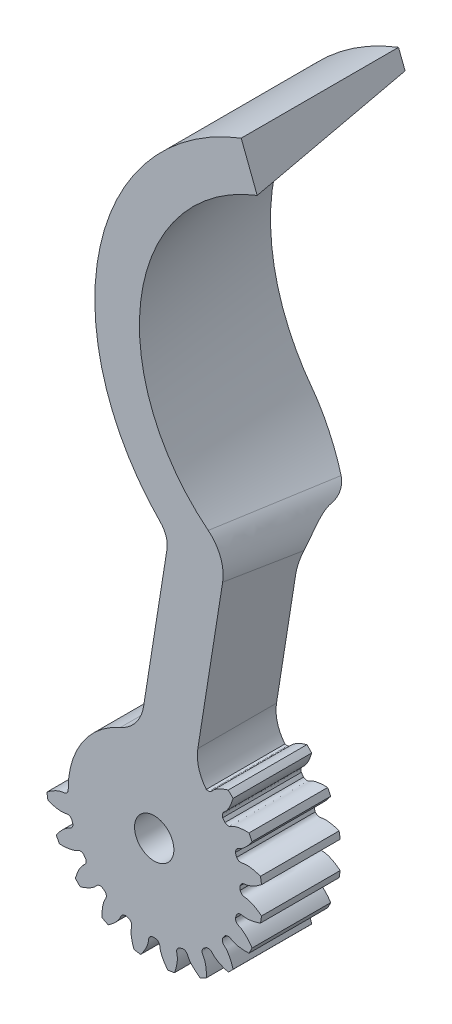
from build123d import *

# Parameters (mm, degrees)
SKETCH_1_R               = 13.75
EXTRUDE_1_DEPTH          = 10
CUT_EXTRUDE_1_DEPTH      = 22.86606960566988
PATTERN_CIRCULAR_1_COUNT = 20
EXTRUDE_2_DEPTH          = 10
EXTRUDE_2_DEPTH_BACK     = 10
CUT_EXTRUDE_3_DEPTH      = 10
CUT_EXTRUDE_3_DEPTH_BACK = 32
SKETCH_16_R              = 2.5
CUT_EXTRUDE_5_DEPTH      = 16.5
SKETCH_19_R              = 8
CUT_EXTRUDE_7_DEPTH      = 3.4
CUT_EXTRUDE_8_DEPTH      = 10
CUT_EXTRUDE_START        = -10
CUT_EXTRUDE_10_DEPTH     = 10
FILLET_7_R               = 5
FILLET_9_R               = 3
FILLET_START             = -13.204378906
FILLET_10_DEPTH          = 16.704378906
FILLET_START_2           = -3.918757741
FILLET_10_2_DEPTH        = 7.418757741
FILLET_START_3           = -7.840442154
FILLET_10_3_DEPTH        = 7.840442154
FILLET_11_R              = 5


with BuildPart() as part:
    # 草图1 → 凸台-拉伸1 (new body)
    with BuildSketch(Plane.XY):
        Circle(SKETCH_1_R)
    extrude(amount=EXTRUDE_1_DEPTH)

    # 草图2 → 切除-拉伸1 (cut, through all)
    with BuildSketch(Plane.XY):
        with BuildLine():
            ThreePointArc((0.2416457505997634, 10.934830295035086), (6.7e-16, 10.937500000000002), (-0.2416457505997634, 10.934830295035086))
            add(Edge.make_bspline(
                [(-0.2416457505997634, 10.934830295035086), (-0.7639867559471274, 11.11684438996315), (-0.6963551242057641, 11.483892123624184), (-0.7661213205046493, 11.837511753136502), (-0.7736152328233113, 11.871945767425867), (-0.7828886122849474, 11.910793269010291), (-0.7941151212463513, 11.953996045052806), (-0.8074739252556283, 12.001489371071028), (-0.8231400688185614, 12.05320353502386), (-0.8412873393390029, 12.109063416272766), (-0.862087187379229, 12.168988683784418), (-0.8857088747961671, 12.232893806456804), (-0.9123192481543054, 12.300688125650764), (-0.9420826277741565, 12.372275913376424), (-0.9751606640715431, 12.447556439261257), (-1.0117122057689227, 12.526424039316826), (-1.0518931668071612, 12.60876818853259), (-1.0958563959484007, 12.694473576645077), (-1.1437515479964713, 12.783420187219072), (-1.1957249570475372, 12.87548337994386), (-1.2519195117493733, 12.970533976112947), (-1.312474532673087, 13.068438347234778), (-1.3775256518637333, 13.169058506725253), (-1.4472046946457964, 13.272252204629972), (-1.5216395637554152, 13.377873025322454), (-1.6009541258709281, 13.485770488123043), (-1.6852681006117873, 13.59579015078136), (-1.7746969520747922, 13.707773715763658), (-1.8693517829750321, 13.821559139284766), (-1.9693392314578595, 13.93698074302268), (-2.0747613706463635, 14.053869328452425), (-2.185715610988071, 14.17205229373418), (-2.302294605461247, 14.291353753089297), (-2.4245861577060728, 14.411594658596073), (-2.5526731331198365, 14.532592924337251), (-2.6866333730491396, 14.654163552823087), (-2.826539611839227, 14.776118763640085), (-2.9724593979402836, 14.898268124165542), (-3.124455014680454, 15.020418682609423), (-3.282583417956758, 15.142375102006111), (-3.4468961243493603, 15.263939800114537), (-3.676841988482957, 15.427049834589285), (-3.8549155156667996, 15.545415751343372), (-3.9764474773063805, 15.622814824574697)],
                knots=[0, 0, 0, 0, 0.1659160033276296, 0.17090592154423187, 0.1766635194393566, 0.18318879701815147, 0.1904817542841364, 0.19854239123982698, 0.20737070788708242, 0.21696670422731487, 0.22733038026162405, 0.2384617359908808, 0.2503607714157882, 0.2630274865369212, 0.27646188135475647, 0.29066395586969274, 0.3056337100820685, 0.3213711439921716, 0.33787625760025025, 0.3551490509065194, 0.37318952391116655, 0.391997676614357, 0.41157350901623546, 0.4319170211169303, 0.45302821291655715, 0.474907084415218, 0.49755363561300586, 0.5209678665100028, 0.5451497771062851, 0.5700993674019202, 0.5958166373969708, 0.6223015870914939, 0.6495542164855408, 0.6775745255791595, 0.7063625143723938, 0.7359181828652848, 0.7662415310578692, 0.7973325589501815, 0.8291912665422545, 0.8618176538341175, 0.8952117208257987, 0.9293734675173234, 1, 1, 1, 1], degree=3))
            ThreePointArc((-3.9764474773063805, 15.622814824574697), (9.9e-16, 16.120932900509423), (3.9764474773063805, 15.622814824574697))
            add(Edge.make_bspline(
                [(0.2416457505997634, 10.934830295035086), (0.7639867559471264, 11.116844389963001), (0.6963551242057642, 11.48389212362419), (0.7661213205046493, 11.837511753136502), (0.7736152328233113, 11.871945767425867), (0.7828886122849474, 11.910793269010291), (0.7941151212463513, 11.953996045052806), (0.8074739252556281, 12.001489371071031), (0.8231400688185614, 12.05320353502386), (0.8412873393390029, 12.109063416272766), (0.862087187379229, 12.168988683784416), (0.885708874796167, 12.232893806456804), (0.9123192481543055, 12.300688125650764), (0.9420826277741565, 12.372275913376424), (0.9751606640715431, 12.447556439261259), (1.011712205768923, 12.526424039316826), (1.051893166807161, 12.60876818853259), (1.0958563959484007, 12.694473576645073), (1.143751547996471, 12.783420187219072), (1.1957249570475375, 12.875483379943862), (1.251919511749373, 12.970533976112947), (1.312474532673087, 13.068438347234776), (1.3775256518637333, 13.169058506725252), (1.4472046946457964, 13.272252204629972), (1.521639563755415, 13.377873025322454), (1.6009541258709281, 13.485770488123041), (1.6852681006117871, 13.59579015078136), (1.7746969520747922, 13.707773715763658), (1.8693517829750321, 13.821559139284766), (1.969339231457859, 13.936980743022678), (2.074761370646364, 14.053869328452427), (2.1857156109880704, 14.17205229373418), (2.302294605461247, 14.291353753089297), (2.4245861577060728, 14.411594658596073), (2.5526731331198365, 14.532592924337251), (2.6866333730491396, 14.654163552823087), (2.826539611839227, 14.776118763640085), (2.972459397940284, 14.898268124165542), (3.1244550146804544, 15.020418682609423), (3.282583417956758, 15.142375102006111), (3.4468961243493608, 15.263939800114537), (3.6768419884829564, 15.427049834589285), (3.854915515666801, 15.545415751343368), (3.9764474773063805, 15.622814824574697)],
                knots=[0, 0, 0, 0, 0.1659160033276296, 0.17090592154423187, 0.1766635194393566, 0.18318879701815147, 0.1904817542841364, 0.19854239123982698, 0.20737070788708242, 0.21696670422731487, 0.22733038026162405, 0.2384617359908808, 0.2503607714157882, 0.2630274865369212, 0.27646188135475647, 0.29066395586969274, 0.3056337100820685, 0.3213711439921716, 0.33787625760025025, 0.3551490509065194, 0.37318952391116655, 0.391997676614357, 0.41157350901623546, 0.4319170211169303, 0.45302821291655715, 0.474907084415218, 0.49755363561300586, 0.5209678665100028, 0.5451497771062851, 0.5700993674019202, 0.5958166373969708, 0.6223015870914939, 0.6495542164855408, 0.6775745255791595, 0.7063625143723938, 0.7359181828652848, 0.7662415310578692, 0.7973325589501815, 0.8291912665422545, 0.8618176538341175, 0.8952117208257987, 0.9293734675173234, 1, 1, 1, 1], degree=3))
        make_face()
    cut_extrude_1 = extrude(amount=CUT_EXTRUDE_1_DEPTH, mode=Mode.SUBTRACT)

    # 阵列(圆周)1: 切除-拉伸1 ×20 about axis
    pattern_circular_1_axis = Axis((0, 0, -1.5000000000000013), (0, 0, 1))
    for i in range(1, PATTERN_CIRCULAR_1_COUNT):
        add(cut_extrude_1.rotate(pattern_circular_1_axis, i * 360 / PATTERN_CIRCULAR_1_COUNT), mode=Mode.SUBTRACT)

    # 草图6 → 凸台-拉伸2 (add, two sides: drawn at the far end of the back side and taken through both)
    with BuildSketch(Plane(origin=(0, 0, 0), x_dir=(-1, 0, 0), z_dir=(0, 0, -1)).offset(-EXTRUDE_2_DEPTH_BACK)):
        with BuildLine():
            Line((-3.4569091920829877, -0.5475206276408102), (3.456909192082978, 0.5475206276408082))
            Line((3.4569091920829775, 0.5475206276408082), (-1.8670604289446535, 34.16174188648786))
            ThreePointArc((-1.867060428944658, 34.16174188648786), (7.038032774036104, 60.95334554573874), (-11.06104827526795, 82.62161674486494))
            Line((-11.06104827526795, 82.62161674486494), (-15.003095720266115, 72.35223205339587))
            Line((-15.003095720266115, 72.35223205339587), (-3.4569091920829873, -0.5475206276408073))
        make_face()
    extrude(amount=EXTRUDE_2_DEPTH + EXTRUDE_2_DEPTH_BACK)

    # 草图7 → 切除-拉伸3 (cut, two sides: drawn at the far end of the back side and taken through both)
    with BuildSketch(Plane(origin=(-3.456909192082979, 0.5475206276408087, 0), x_dir=(0, 0, -1), z_dir=(0.9876883405951378, -0.15643446504023117, 0)).offset(-CUT_EXTRUDE_3_DEPTH_BACK)):
        Polygon((0, 0), (0, 34), (10, 34), (9.999999999999998, -1.1e-16), align=None)
        Polygon((-20.000000000000004, 34), (-20, -1.1e-16), (-10.000000000000002, 1.73e-15), (-10.000000000000002, 34), align=None)
    extrude(amount=CUT_EXTRUDE_3_DEPTH + CUT_EXTRUDE_3_DEPTH_BACK, mode=Mode.SUBTRACT)

    # 草图16 → 切除-拉伸5 (cut)
    with BuildSketch(Plane.XY.offset(10)):
        Circle(SKETCH_16_R)
    extrude(amount=-CUT_EXTRUDE_5_DEPTH, mode=Mode.SUBTRACT)

    # 草图19 → 切除-拉伸7 (cut)
    with BuildSketch(Plane(origin=(0, 0, 0), x_dir=(-1, 0, 0), z_dir=(0, 0, -1))):
        Circle(SKETCH_19_R)
    extrude(amount=-CUT_EXTRUDE_7_DEPTH, mode=Mode.SUBTRACT)

    # 草图20 → 切除-拉伸8 (cut)
    with BuildSketch(Plane(origin=(0, 0, 0), x_dir=(-1, 0, 0), z_dir=(0, 0, -1))):
        with BuildLine():
            add(Edge.make_bspline(
                [(3.6088671575148004, 10.324968963120957), (4.1618884229271185, 10.336662406648628), (4.21099090629989, 10.70664486910371), (4.38661697697095, 11.021398181752025), (4.4043848067141225, 11.051831129163304), (4.425208852857784, 11.085911666838022), (4.449236289362085, 11.12353076645872), (4.476617511824038, 11.164571506185489), (4.5074974552560985, 11.208913494200324), (4.542018187747214, 11.256431583269233), (4.580317944817384, 11.306996392902072), (4.622531273494534, 11.36047427339664), (4.668788839230852, 11.416727444839523), (4.7192173383622125, 11.475614086730598), (4.773939382172986, 11.536988446067053), (4.83307339280765, 11.600700943469365), (4.896733499129087, 11.666598283348664), (4.965029436117499, 11.734523566262407), (5.038066446831178, 11.804316403920147), (5.1159451872916435, 11.875813036619615), (5.198761634262848, 11.948846453089763), (5.286606996006972, 12.023246512658801), (5.379567626064803, 12.098840069679856), (5.477724940116846, 12.175451100141293), (5.5811553359769315, 12.252900830388375), (5.6899301167693075, 12.331007867881487), (5.781365353078071, 12.393932109839398), (5.83655242253128, 12.430773747401965), (5.853360337646368, 12.44189184801359)],
                knots=[0, 0, 0, 0, 0.1659160033276296, 0.17090592154423187, 0.1766635194393566, 0.18318879701815147, 0.1904817542841364, 0.19854239123982698, 0.20737070788708242, 0.21696670422731487, 0.22733038026162405, 0.2384617359908808, 0.2503607714157882, 0.2630274865369212, 0.27646188135475647, 0.29066395586969274, 0.3056337100820685, 0.3213711439921716, 0.33787625760025025, 0.3551490509065194, 0.37318952391116655, 0.391997676614357, 0.41157350901623546, 0.4319170211169303, 0.45302821291655715, 0.474907084415218, 0.49755363561300586, 0.5074316978669352, 0.5074316978669352, 0.5074316978669352, 0.5074316978669352], degree=3))
            ThreePointArc((3.608867157514803, 10.324968963120957), (4.965521090901294, 9.745383858310275), (6.231836464888878, 8.988499347771091))
            add(Edge.make_bspline(
                [(6.231836464888878, 8.988499347771093), (5.916238915411957, 9.442776183394354), (6.18669929958145, 9.699971161947017), (6.338109664291217, 10.027062993060076), (6.352286767647581, 10.059325506947605), (6.3676184345875635, 10.096204551604872), (6.383929952666169, 10.137755108029685), (6.4010383298139715, 10.184030123882737), (6.418760976341348, 10.235076089517058), (6.436913140481708, 10.290934380732466), (6.455308898419778, 10.351640784469824), (6.473761040516433, 10.41722559423734), (6.492081297254455, 10.487713535605245), (6.510080463201349, 10.56312374806394), (6.52756855259614, 10.643469754760654), (6.544354946388719, 10.728759440669448), (6.560248542580063, 10.818995033093563), (6.575057906251721, 10.914173086318437), (6.588591420233458, 11.014284469895014), (6.600657436018135, 11.119314360717366), (6.611064424922814, 11.229242238856507), (6.61962112938118, 11.344041887168881), (6.6261367142846535, 11.463681394678774), (6.630420918280104, 11.58812316373724), (6.632284204934418, 11.717323920956243), (6.631537913675521, 11.85123473191539), (6.628700411335462, 11.962193333408427), (6.626067776682344, 12.028495581695422), (6.625183064395886, 12.048628526236572)],
                knots=[0, 0, 0, 0, 0.1659160033276296, 0.17090592154423187, 0.1766635194393566, 0.18318879701815147, 0.1904817542841364, 0.19854239123982698, 0.20737070788708242, 0.21696670422731487, 0.22733038026162405, 0.2384617359908808, 0.2503607714157882, 0.2630274865369212, 0.27646188135475647, 0.29066395586969274, 0.3056337100820685, 0.3213711439921716, 0.33787625760025025, 0.3551490509065194, 0.37318952391116655, 0.391997676614357, 0.41157350901623546, 0.4319170211169303, 0.45302821291655715, 0.474907084415218, 0.49755363561300586, 0.507431697866943, 0.507431697866943, 0.507431697866943, 0.507431697866943], degree=3))
            ThreePointArc((6.625183064395895, 12.048628526236577), (6.242369371418751, 12.251339707590063), (5.853360337646374, 12.44189184801364))
        make_face()
        with BuildLine():
            add(Edge.make_bspline(
                [(6.622827502596276, 8.70442773080772), (7.152395453489266, 8.544655887209494), (7.313425558786526, 8.881356617214127), (7.5777200003736915, 9.126433365741141), (7.604022508570362, 9.149886257342903), (7.634358818669846, 9.175863790627249), (7.668835209823009, 9.204216794247577), (7.7075585859068685, 9.234787594130788), (7.750629585191708, 9.267416903471933), (7.798144649837181, 9.301941798724787), (7.85019526886517, 9.33819651460621), (7.906868104074056, 9.376012365377846), (7.96824484935887, 9.41521793670993), (8.034402175150749, 9.455639197970765), (8.105411651555814, 9.497099640846677), (8.181339682155963, 9.539420412438927), (8.262247439007812, 9.582420452220612), (8.348190801685197, 9.625916629980738), (8.439220299577055, 9.669723885496989), (8.535381057717558, 9.713655369616177), (8.636712746112472, 9.757522586729557), (8.74324953261487, 9.80113553853949), (8.855020039375031, 9.844302869038621), (8.972047302895415, 9.886832010614778), (9.094348737717242, 9.928529331195872), (9.221936103764062, 9.969200282347954), (9.328340841197715, 10.000789750790878), (9.392211555323922, 10.018774487934964), (9.411632514553686, 10.024154498559916)],
                knots=[0, 0, 0, 0, 0.1659160033276296, 0.17090592154423187, 0.1766635194393566, 0.18318879701815147, 0.1904817542841364, 0.19854239123982698, 0.20737070788708242, 0.21696670422731487, 0.22733038026162405, 0.2384617359908808, 0.2503607714157882, 0.2630274865369212, 0.27646188135475647, 0.29066395586969274, 0.3056337100820685, 0.3213711439921716, 0.33787625760025025, 0.3551490509065194, 0.37318952391116655, 0.391997676614357, 0.41157350901623546, 0.4319170211169303, 0.45302821291655715, 0.474907084415218, 0.49755363561300586, 0.5074316978669668, 0.5074316978669668, 0.5074316978669668, 0.5074316978669668], degree=3))
            ThreePointArc((6.622827502596277, 8.70442773080772), (7.733980419227866, 7.733980419227864), (8.70442773080772, 6.622827502596277))
            add(Edge.make_bspline(
                [(8.70442773080772, 6.622827502596276), (8.544655887209373, 7.152395453489178), (8.881356617214132, 7.3134255587865304), (9.126433365741141, 7.5777200003736915), (9.149886257342903, 7.604022508570362), (9.175863790627249, 7.634358818669846), (9.204216794247577, 7.668835209823009), (9.234787594130792, 7.70755858590687), (9.267416903471933, 7.750629585191708), (9.301941798724787, 7.798144649837181), (9.338196514606208, 7.8501952688651695), (9.376012365377846, 7.906868104074056), (9.41521793670993, 7.96824484935887), (9.455639197970765, 8.034402175150749), (9.49709964084668, 8.105411651555816), (9.539420412438927, 8.181339682155963), (9.582420452220612, 8.262247439007812), (9.625916629980734, 8.348190801685195), (9.669723885496989, 8.439220299577055), (9.713655369616179, 8.53538105771756), (9.757522586729557, 8.636712746112472), (9.801135538539487, 8.743249532614868), (9.84430286903862, 8.85502003937503), (9.886832010614778, 8.972047302895415), (9.928529331195872, 9.094348737717242), (9.969200282347952, 9.22193610376406), (10.00078975079085, 9.328340841197623), (10.018774487934913, 9.392211555323733), (10.024154498559842, 9.411632514553405)],
                knots=[0, 0, 0, 0, 0.1659160033276296, 0.17090592154423187, 0.1766635194393566, 0.18318879701815147, 0.1904817542841364, 0.19854239123982698, 0.20737070788708242, 0.21696670422731487, 0.22733038026162405, 0.2384617359908808, 0.2503607714157882, 0.2630274865369212, 0.27646188135475647, 0.29066395586969274, 0.3056337100820685, 0.3213711439921716, 0.33787625760025025, 0.3551490509065194, 0.37318952391116655, 0.391997676614357, 0.41157350901623546, 0.4319170211169303, 0.45302821291655715, 0.474907084415218, 0.49755363561300586, 0.5074316978669199, 0.5074316978669199, 0.5074316978669199, 0.5074316978669199], degree=3))
            ThreePointArc((10.024154498559962, 9.411632514553464), (9.722718241315107, 9.722718241314944), (9.41163251455363, 10.024154498559806))
        make_face()
        with BuildLine():
            ThreePointArc((10.474314250228591, 3.1492296260289243), (10.80284122525932, 1.7110019613775267), (10.934830295035086, 0.2416457505997647))
            add(Edge.make_bspline(
                [(10.934830295035086, 0.24164575059976462), (11.116844389963001, 0.7639867559471276), (11.48389212362419, 0.6963551242057654), (11.837511753136502, 0.7661213205046506), (11.871945767425867, 0.7736152328233127), (11.910793269010291, 0.7828886122849488), (11.953996045052806, 0.7941151212463526), (12.001489371071031, 0.8074739252556294), (12.05320353502386, 0.8231400688185627), (12.109063416272766, 0.8412873393390042), (12.168988683784416, 0.8620871873792303), (12.232893806456804, 0.8857088747961683), (12.300688125650764, 0.9123192481543069), (12.372275913376424, 0.9420826277741579), (12.447556439261259, 0.9751606640715444), (12.526424039316826, 1.0117122057689243), (12.60876818853259, 1.0518931668071623), (12.694473576645073, 1.095856395948402), (12.783420187219072, 1.1437515479964724), (12.875483379943862, 1.1957249570475388), (12.970533976112947, 1.2519195117493744), (13.068438347234776, 1.3124745326730884), (13.169058506725252, 1.3775256518637349), (13.272252204629972, 1.447204694645798), (13.377873025322454, 1.5216395637554165), (13.485770488123041, 1.6009541258709297), (13.573870040374116, 1.6684695430581908), (13.625962262179746, 1.7095708729694425), (13.641730135625805, 1.7221204681307989)],
                knots=[0, 0, 0, 0, 0.1659160033276296, 0.17090592154423187, 0.1766635194393566, 0.18318879701815147, 0.1904817542841364, 0.19854239123982698, 0.20737070788708242, 0.21696670422731487, 0.22733038026162405, 0.2384617359908808, 0.2503607714157882, 0.2630274865369212, 0.27646188135475647, 0.29066395586969274, 0.3056337100820685, 0.3213711439921716, 0.33787625760025025, 0.3551490509065194, 0.37318952391116655, 0.391997676614357, 0.41157350901623546, 0.4319170211169303, 0.45302821291655715, 0.474907084415218, 0.49755363561300586, 0.507431697866919, 0.507431697866919, 0.507431697866919, 0.507431697866919], degree=3))
            ThreePointArc((13.641730135625945, 1.7221204681307698), (13.580714683183153, 2.1509738943030916), (13.506220830040403, 2.5776925515240823))
            add(Edge.make_bspline(
                [(10.474314250228593, 3.1492296260289234), (10.808832188778723, 2.7086992577136986), (11.137016004103026, 2.886444749237065), (11.49488719732985, 2.929367628693762), (11.529951637262773, 2.9328811901505176), (11.56976343863536, 2.936066220364046), (11.61432090236921, 2.9387395678623687), (11.663617837022759, 2.9407108351184563), (11.71764203423212, 2.9417920027090307), (11.776375753285702, 2.9417945754372727), (11.839795575968235, 2.940530670474232), (11.907872462158096, 2.9378128796638485), (11.980571748789632, 2.9334545074335576), (12.057853170905844, 2.9272696942960668), (12.139670880955183, 2.919073574173087), (12.225973473467688, 2.908682420983897), (12.316704012969252, 2.8959137976524962), (12.411800065747482, 2.8805867035366024), (12.511193735267273, 2.8625217213417526), (12.6148117012715, 2.8415411630980385), (12.722575262530048, 2.81746921521027), (12.834400383219403, 2.790132082466621), (12.950197742906497, 2.7593581309273385), (13.069872790110809, 2.724978029605201), (13.193325799415783, 2.686824890852728), (13.320451932099099, 2.644734409370993), (13.42510299664341, 2.607747690747045), (13.487346653073999, 2.5847553849192164), (13.506220830040439, 2.5776925515241036)],
                knots=[0, 0, 0, 0, 0.1659160033276296, 0.17090592154423187, 0.1766635194393566, 0.18318879701815147, 0.1904817542841364, 0.19854239123982698, 0.20737070788708242, 0.21696670422731487, 0.22733038026162405, 0.2384617359908808, 0.2503607714157882, 0.2630274865369212, 0.27646188135475647, 0.29066395586969274, 0.3056337100820685, 0.3213711439921716, 0.33787625760025025, 0.3551490509065194, 0.37318952391116655, 0.391997676614357, 0.41157350901623546, 0.4319170211169303, 0.45302821291655715, 0.474907084415218, 0.49755363561300586, 0.5074316978669523, 0.5074316978669523, 0.5074316978669523, 0.5074316978669523], degree=3))
        make_face()
        with BuildLine():
            add(Edge.make_bspline(
                [(8.988499347771093, 6.231836464888878), (9.442776183394475, 5.916238915412043), (9.699971161947012, 6.186699299581446), (10.027062993060076, 6.338109664291217), (10.059325506947605, 6.352286767647581), (10.096204551604872, 6.3676184345875635), (10.137755108029685, 6.383929952666169), (10.184030123882733, 6.40103832981397), (10.235076089517058, 6.418760976341348), (10.290934380732466, 6.436913140481708), (10.351640784469826, 6.455308898419779), (10.41722559423734, 6.473761040516433), (10.487713535605245, 6.492081297254455), (10.56312374806394, 6.510080463201349), (10.643469754760652, 6.527568552596139), (10.728759440669448, 6.544354946388719), (10.818995033093563, 6.560248542580063), (10.91417308631844, 6.575057906251723), (11.014284469895014, 6.588591420233458), (11.119314360717365, 6.600657436018135), (11.229242238856507, 6.611064424922813), (11.344041887168881, 6.61962112938118), (11.463681394678776, 6.626136714284655), (11.58812316373724, 6.630420918280104), (11.717323920956243, 6.632284204934418), (11.851234731915392, 6.631537913675522), (11.962193333408427, 6.628700411335464), (12.028495581695418, 6.626067776682344), (12.048628526236568, 6.625183064395886)],
                knots=[0, 0, 0, 0, 0.1659160033276296, 0.17090592154423187, 0.1766635194393566, 0.18318879701815147, 0.1904817542841364, 0.19854239123982698, 0.20737070788708242, 0.21696670422731487, 0.22733038026162405, 0.2384617359908808, 0.2503607714157882, 0.2630274865369212, 0.27646188135475647, 0.29066395586969274, 0.3056337100820685, 0.3213711439921716, 0.33787625760025025, 0.3551490509065194, 0.37318952391116655, 0.391997676614357, 0.41157350901623546, 0.4319170211169303, 0.45302821291655715, 0.474907084415218, 0.49755363561300586, 0.5074316978669424, 0.5074316978669424, 0.5074316978669424, 0.5074316978669424], degree=3))
            ThreePointArc((8.988499347771091, 6.231836464888878), (9.745383858310275, 4.965521090901294), (10.324968963120957, 3.6088671575148017))
            add(Edge.make_bspline(
                [(10.324968963120957, 3.608867157514801), (10.336662406648486, 4.161888422927072), (10.706644869103718, 4.210990906299893), (11.021398181752025, 4.386616976970951), (11.051831129163304, 4.404384806714123), (11.085911666838022, 4.425208852857784), (11.12353076645872, 4.449236289362085), (11.164571506185492, 4.476617511824039), (11.208913494200324, 4.5074974552560985), (11.256431583269233, 4.542018187747214), (11.306996392902072, 4.580317944817385), (11.36047427339664, 4.622531273494535), (11.416727444839523, 4.668788839230852), (11.475614086730598, 4.719217338362213), (11.536988446067054, 4.773939382172988), (11.600700943469365, 4.833073392807652), (11.666598283348664, 4.896733499129088), (11.734523566262403, 4.965029436117498), (11.804316403920147, 5.038066446831179), (11.875813036619615, 5.115945187291645), (11.948846453089763, 5.198761634262848), (12.0232465126588, 5.286606996006973), (12.098840069679854, 5.379567626064803), (12.175451100141293, 5.477724940116846), (12.252900830388375, 5.581155335976932), (12.331007867881485, 5.689930116769308), (12.393932109839348, 5.781365353078), (12.430773747401865, 5.836552422531135), (12.44189184801344, 5.853360337646148)],
                knots=[0, 0, 0, 0, 0.1659160033276296, 0.17090592154423187, 0.1766635194393566, 0.18318879701815147, 0.1904817542841364, 0.19854239123982698, 0.20737070788708242, 0.21696670422731487, 0.22733038026162405, 0.2384617359908808, 0.2503607714157882, 0.2630274865369212, 0.27646188135475647, 0.29066395586969274, 0.3056337100820685, 0.3213711439921716, 0.33787625760025025, 0.3551490509065194, 0.37318952391116655, 0.391997676614357, 0.41157350901623546, 0.4319170211169303, 0.45302821291655715, 0.474907084415218, 0.49755363561300586, 0.5074316978668918, 0.5074316978668918, 0.5074316978668918, 0.5074316978668918], degree=3))
            ThreePointArc((12.441891848013736, 5.853360337646177), (12.251339707590114, 6.242369371418656), (12.048628526236579, 6.625183064395899))
        make_face()
    extrude(amount=-CUT_EXTRUDE_8_DEPTH, mode=Mode.SUBTRACT)

    # 草图23 → 切除-拉伸10 (cut)
    with BuildSketch(Plane.XY.offset(10).offset(CUT_EXTRUDE_START)):
        with BuildLine():
            Line((-1.83587591845477, 10.782321914227843), (-1.4426701552683983, 13.264925397137674))
            add(Edge.make_bspline(
                [(-1.7221204681308946, 13.641730135625926), (-1.6530035002535302, 13.554888481496597), (-1.5584465335635709, 13.430243962918864), (-1.468411433508971, 13.302341753075098), (-1.4426701552652714, 13.264925397133126)],
                knots=[0.4925683021330556, 0.4925683021330556, 0.4925683021330556, 0.4925683021330556, 0.5469717870834429, 0.5692331940336579, 0.5692331940336579, 0.5692331940336579, 0.5692331940336579], degree=3))
            ThreePointArc((-1.7221204681308957, 13.641730135625927), (-2.150973894303179, 13.580714683183139), (-2.5776925515241293, 13.506220830040391))
            add(Edge.make_bspline(
                [(-3.149229626028932, 10.474314250228593), (-2.7086992577136604, 10.80883218877858), (-2.8864447492370755, 11.137016004103035), (-2.930953036387588, 11.508105596242487), (-2.9353627078580327, 11.558037790176622), (-2.9398182870229714, 11.632300229750824), (-2.9423966331802007, 11.72233524960857), (-2.9410425677409924, 11.844511956896943), (-2.9338719296351234, 11.985311432107002), (-2.919395231973933, 12.144433807509355), (-2.896138190534945, 12.321490073792004), (-2.8626472725975356, 12.516002729157018), (-2.817494227840954, 12.727406896160995), (-2.7592807935456625, 12.955051619418102), (-2.6866432765122377, 13.198201409041735), (-2.6232143066812186, 13.383232523296419), (-2.5847553849192364, 13.48734665307397), (-2.57769255152413, 13.506220830040395)],
                knots=[0, 0, 0, 0, 0.1659160033276296, 0.17090592154423187, 0.18318879701815147, 0.1904817542841364, 0.20737070788708242, 0.22733038026162405, 0.2503607714157882, 0.27646188135475647, 0.3056337100820685, 0.33787625760025025, 0.37318952391116655, 0.41157350901623546, 0.45302821291655715, 0.49755363561300586, 0.5074316978669445, 0.5074316978669445, 0.5074316978669445, 0.5074316978669445], degree=3))
            ThreePointArc((-3.1492296260289305, 10.474314250228595), (-2.4973058488461333, 10.648585340190452), (-1.8358759184547695, 10.782321914227843))
        make_face()
        with BuildLine():
            Line((5.471148227277864, 12.169884131738412), (5.077942465691386, 9.687280658942848))
            ThreePointArc((5.077942465691388, 9.687280658942848), (5.665672836906432, 9.355696529662595), (6.231836464888763, 8.988499347771175))
            add(Edge.make_bspline(
                [(6.625183064395726, 12.048628526236675), (6.630055622426282, 11.937746217824925), (6.634099243484723, 11.742167573641334), (6.627563174635646, 11.468321551944427), (6.612581386769511, 11.233829592286828), (6.590197021757168, 11.018819212234796), (6.561941090453101, 10.823477402666905), (6.529346488954814, 10.647900044878973), (6.493943196533024, 10.49209208457522), (6.462349250209951, 10.374874099437111), (6.431689653644747, 10.273696759869056), (6.407827368338847, 10.20239322534229), (6.383929952666036, 10.137755108029767), (6.3633259297904665, 10.085270194550601), (6.343702186511706, 10.039144519560606), (6.186699299581319, 9.699971161947094), (5.916238915411919, 9.442776183394551), (6.23183646488876, 8.988499347771171)],
                knots=[0.4925683021330544, 0.4925683021330544, 0.4925683021330544, 0.4925683021330544, 0.5469717870834429, 0.5884264909837645, 0.6268104760888334, 0.6621237423997497, 0.6943662899179315, 0.7235381186452435, 0.7496392285842117, 0.772669619738376, 0.7830332957726851, 0.801457608760173, 0.8095182457158636, 0.8168112029818485, 0.8290940784557681, 0.8340839966723704, 1, 1, 1, 1], degree=3))
            ThreePointArc((6.625183064395726, 12.048628526236673), (6.242369371418608, 12.251339707590144), (5.853360337646256, 12.4418918480137))
            add(Edge.make_bspline(
                [(5.471148222972666, 12.16988413734541), (5.5426162578475715, 12.224670494170722), (5.668770252822995, 12.317179358658214), (5.798018416533145, 12.405284271002404), (5.853360337652429, 12.441891848017784)],
                knots=[0.430766804754415, 0.430766804754415, 0.430766804754415, 0.430766804754415, 0.474907084415218, 0.5074316978681545, 0.5074316978681545, 0.5074316978681545, 0.5074316978681545], degree=3))
        make_face()
    extrude(amount=CUT_EXTRUDE_10_DEPTH, mode=Mode.SUBTRACT)

    # 圆角7
    # the kernel refuses this fillet: 5 mm, written as the material it adds along each edge
    with BuildSketch(Plane(origin=(-1.83587591845477, 10.782321914227843, 0), x_dir=(-0.95908234838472, -0.2831272664666028, 0), z_dir=(0, 0, 1))) as fillet_7_piece_1:
        with BuildLine():
            CenterArc((3.1746608644869587, -4.964992527040746), FILLET_7_R, 96.78401387529684, 57.76904736461498)
            Line((-1.3402570890257, -2.8166173565807378), (0, 0))
            ThreePointArc((0, 0), (1.292013142523785, -0.07657884709837615), (2.58402628504757, 6e-17))
        make_face()
    fillet_7_piece_1_solid = extrude(amount=10, mode=Mode.PRIVATE)
    with BuildSketch(Plane(origin=(5.077942465691387, 9.687280658942848, 0), x_dir=(0.15643446504023167, 0.9876883405951375, 0), z_dir=(0, 0, 1))) as fillet_7_piece_2:
        with BuildLine():
            CenterArc((3.0092436125986284, -4.999999999999999), FILLET_7_R, 89.99999999999999, 48.38847655656498)
            ThreePointArc((-0.729079113341984, -1.6796170105368944), (-0.32933002005835404, -0.8550920714467386), (0, 0))
            Line((0, 0), (3.0092436125986293, -1e-17))
        make_face()
    fillet_7_piece_2_solid = extrude(amount=10, mode=Mode.PRIVATE)
    add([fillet_7_piece_1_solid, fillet_7_piece_2_solid])

    # 草图25 → 切除-旋转1 (revolve, cut)
    with BuildSketch(Plane(origin=(12.346104257439235, -1.955430813002805, 0), x_dir=(0, 0, -1), z_dir=(0.9876883405951388, -0.1564344650402244, 0))):
        Polygon((-30, 58.22), (30, 58.22), (30.000000000000004, 88.22), (-30.000000000000004, 78.22), align=None)
    revolve(axis=Axis((21.4537188120811, 55.54778437644618, -7.100000000000002), (0, 0, 1)), mode=Mode.SUBTRACT)

    # 圆角9
    fillet_9_edges = [part.edges().sort_by_distance(p)[0] for p in [
        (1.8670604289446557, 34.16174188648786, 0),
    ]]
    fillet(fillet_9_edges, radius=FILLET_9_R)

    # 圆角10: read off the stored shape, not the designer's step
    # 圆角10 outline → 圆角10 (cut)
    with BuildSketch(Plane(origin=(0, 0, 0), x_dir=(0.156434465040231, 0.9876883405951378, 0), z_dir=(0.9876883405951378, -0.15643446504023098, 0)).offset(FILLET_START)):
        with BuildLine():
            Line((34, -10), (39, -10))
            ThreePointArc((39, -10), (35.464466094, -8.535533906), (34, -5))
            Line((34, -5), (34, -10))
        make_face()
    extrude(amount=FILLET_10_DEPTH, mode=Mode.SUBTRACT)

    # Fillet 10 2 outline → Fillet 10 2 (add)
    with BuildSketch(Plane(origin=(0, 0, 0), x_dir=(0.156434465040231, 0.9876883405951378, 0), z_dir=(0.9876883405951378, -0.15643446504023098, 0)).offset(FILLET_START_2)):
        with BuildLine():
            ThreePointArc((29, 0), (32.535533906, -1.464466094), (34, -5))
            Line((34, -5), (34, 0))
            Line((34, 0), (29, 0))
        make_face()
    extrude(amount=FILLET_10_2_DEPTH)

    # Fillet 10 3 outline → Fillet 10 3 (cut)
    with BuildSketch(Plane.XY.offset(FILLET_START_3)):
        with BuildLine():
            Line((0.891136388, 28), (1.62270774, 32.618959726))
            ThreePointArc((1.62270774, 32.618959726), (1.641419456, 33.418425942), (1.448260575, 34.194432388))
            Line((1.448260575, 34.194432388), (0.666088156, 29.255990648))
            Line((0.666088156, 29.255990648), (0.46715878, 28))
            Line((0.46715878, 28), (0.891136388, 28))
        make_face()
    extrude(amount=FILLET_10_3_DEPTH, mode=Mode.SUBTRACT)

    # 圆角11
    fillet_11_edges = [part.edges().sort_by_distance(p)[0] for p in [
        (8.985460032550279, 34.358375615317506, 2.4867912930384932),
    ]]
    fillet(fillet_11_edges, radius=FILLET_11_R)


solid = part.part
